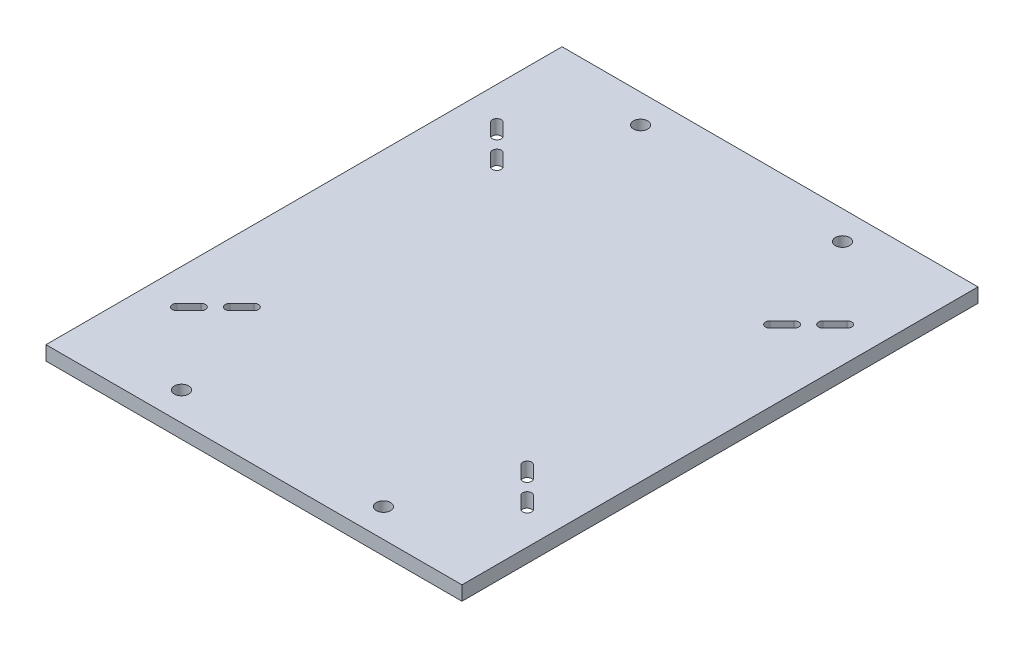
from build123d import *

# Parameters (mm, degrees)
SKETCH1_W              = 185.4
SKETCH1_H              = 230
BASE_PLATE_DEPTH       = 6.35
SLOTS_DEPTH            = 296.488548847
FEET_CONNECTION_HOLE_D = 6.35


with BuildPart() as part:
    # Sketch1 → base plate (new body)
    with BuildSketch(Plane(origin=(0, 0, 0), x_dir=(1, 0, 0), z_dir=(0, 1, 0))):
        with Locations((92.7, -115)):
            Rectangle(SKETCH1_W, SKETCH1_H)
    extrude(amount=-BASE_PLATE_DEPTH)

    # Sketch3 → slots (cut, through all)
    with BuildSketch(Plane(origin=(0, 0, 0), x_dir=(1, 0, 0), z_dir=(0, 1, 0))):
        with BuildLine():
            Line((18.59618524, -179.525387544), (13.208031568, -184.913541217))
            ThreePointArc((13.208031568, -184.913541217), (13.208031568, -187.741968432), (16.036458783, -187.741968432))
            Line((16.036458783, -187.741968432), (21.424612456, -182.35381476))
            ThreePointArc((21.424612456, -182.35381476), (21.424612456, -179.525387544), (18.59618524, -179.525387544))
        make_face()
        with BuildLine():
            Line((27.845142119, -175.933285096), (33.233295792, -170.545131423))
            ThreePointArc((33.233295792, -170.545131423), (33.233295792, -167.716704208), (30.404868577, -167.716704208))
            Line((30.404868577, -167.716704208), (25.016714904, -173.104857881))
            ThreePointArc((25.016714904, -173.104857881), (25.016714904, -175.933285096), (27.845142119, -175.933285096))
        make_face()
        with BuildLine():
            ThreePointArc((16.036458783, -42.258031568), (13.208031568, -42.258031568), (13.208031568, -45.086458783))
            Line((13.208031568, -45.086458783), (18.59618524, -50.474612456))
            ThreePointArc((18.59618524, -50.474612456), (21.424612456, -50.474612456), (21.424612456, -47.64618524))
            Line((21.424612456, -47.64618524), (16.036458783, -42.258031568))
        make_face()
        with BuildLine():
            ThreePointArc((30.404868577, -62.283295792), (33.233295792, -62.283295792), (33.233295792, -59.454868577))
            Line((33.233295792, -59.454868577), (27.845142119, -54.066714904))
            ThreePointArc((27.845142119, -54.066714904), (25.016714904, -54.066714904), (25.016714904, -56.895142119))
            Line((25.016714904, -56.895142119), (30.404868577, -62.283295792))
        make_face()
        with BuildLine():
            Line((166.80381476, -50.474612456), (172.191968432, -45.086458783))
            ThreePointArc((172.191968432, -45.086458783), (172.191968432, -42.258031568), (169.363541217, -42.258031568))
            Line((169.363541217, -42.258031568), (163.975387544, -47.64618524))
            ThreePointArc((163.975387544, -47.64618524), (163.975387544, -50.474612456), (166.80381476, -50.474612456))
        make_face()
        with BuildLine():
            Line((157.554857881, -54.066714904), (152.166704208, -59.454868577))
            ThreePointArc((152.166704208, -59.454868577), (152.166704208, -62.283295792), (154.995131423, -62.283295792))
            Line((154.995131423, -62.283295792), (160.383285096, -56.895142119))
            ThreePointArc((160.383285096, -56.895142119), (160.383285096, -54.066714904), (157.554857881, -54.066714904))
        make_face()
        with BuildLine():
            ThreePointArc((154.995131423, -167.716704208), (152.166704208, -167.716704208), (152.166704208, -170.545131423))
            Line((152.166704208, -170.545131423), (157.554857881, -175.933285096))
            ThreePointArc((157.554857881, -175.933285096), (160.383285096, -175.933285096), (160.383285096, -173.104857881))
            Line((160.383285096, -173.104857881), (154.995131423, -167.716704208))
        make_face()
        with BuildLine():
            ThreePointArc((169.363541217, -187.741968432), (172.191968432, -187.741968432), (172.191968432, -184.913541217))
            Line((172.191968432, -184.913541217), (166.80381476, -179.525387544))
            ThreePointArc((166.80381476, -179.525387544), (163.975387544, -179.525387544), (163.975387544, -182.35381476))
            Line((163.975387544, -182.35381476), (169.363541217, -187.741968432))
        make_face()
    extrude(amount=-SLOTS_DEPTH, mode=Mode.SUBTRACT)

    # Feet connection hole (through all)
    with Locations(Plane(origin=(0, 0, 0), x_dir=(1, 0, 0), z_dir=(0, 1, 0))):
        with Locations((47.7, -217.3), (137.7, -12.7), (47.7, -12.7), (137.7, -217.3)):
            Hole(FEET_CONNECTION_HOLE_D / 2)


solid = part.part
